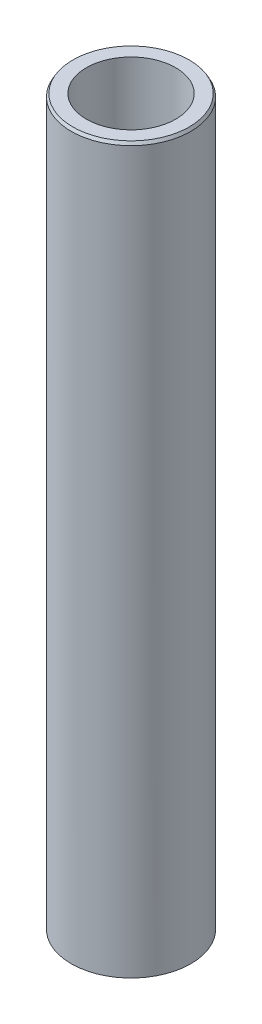
from build123d import *
from OCP.BRepFilletAPI import BRepFilletAPI_MakeChamfer

# Parameters (mm, degrees)
SKETCH1_R           = 27.5
BOSS_EXTRUDE1_DEPTH = 333.37166807
SKETCH2_R           = 20.527541027
CUT_EXTRUDE1_DEPTH  = 336.632491085
CHAMFER1_SIZE       = 1.35368439
CHAMFER1_SIZE2      = 0.781550047


with BuildPart() as part:
    # Sketch1 → Boss-Extrude1 (new body)
    with BuildSketch(Plane(origin=(0, 0, 0), x_dir=(1, 0, 0), z_dir=(0, 1, 0))):
        Circle(SKETCH1_R)
    extrude(amount=BOSS_EXTRUDE1_DEPTH)

    # Sketch2 → Cut-Extrude1 (cut, through all)
    with BuildSketch(Plane(origin=(0, 0, 0), x_dir=(1, 0, 0), z_dir=(0, 1, 0))):
        Circle(SKETCH2_R)
    extrude(amount=CUT_EXTRUDE1_DEPTH, mode=Mode.SUBTRACT)

    # Chamfer1: one chamfer whose edges measure the first distance from different faces: ONE call of the kernel's chamfer builder (chamfer() names one face for all edges)
    chamfer1_edges_1 = [part.edges().sort_by_distance(p)[0] for p in [
        (-27.5, 333.37166807, 0),
    ]]
    chamfer1_side_1 = [part.faces().sort_by_distance(p)[0] for p in [
        (-27.5, 166.685834035, 0),
    ]]
    chamfer1_edges_2 = [part.edges().sort_by_distance(p)[0] for p in [
        (-27.5, 0, 0),
    ]]
    chamfer1_side_2 = [part.faces().sort_by_distance(p)[0] for p in [
        (-26.722182541, 0, 0),
    ]]
    chamfer1 = BRepFilletAPI_MakeChamfer(part.part.solid().wrapped)
    for e in chamfer1_edges_1:
        chamfer1.Add(CHAMFER1_SIZE, CHAMFER1_SIZE2, e.wrapped, chamfer1_side_1[0].wrapped)  # the first distance lies on this face
    for e in chamfer1_edges_2:
        chamfer1.Add(CHAMFER1_SIZE, CHAMFER1_SIZE2, e.wrapped, chamfer1_side_2[0].wrapped)  # the first distance lies on this face
    add(Compound.cast(chamfer1.Shape()), mode=Mode.REPLACE)


solid = part.part
